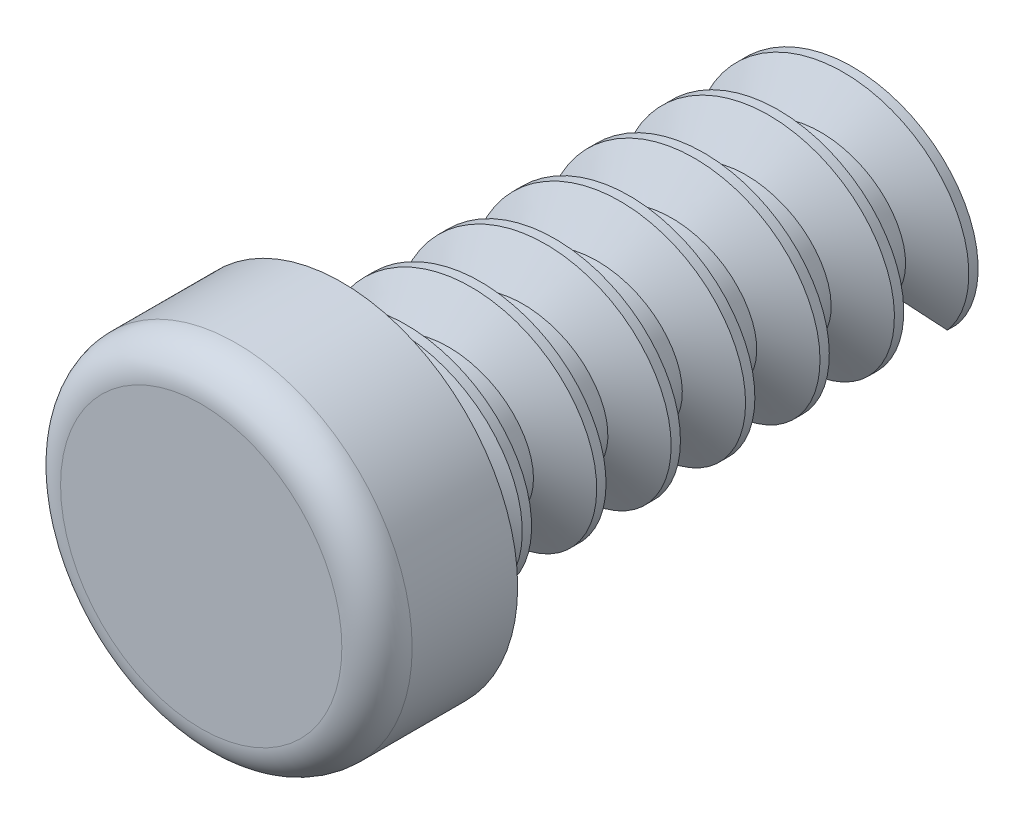
from build123d import *

# Parameters (mm, degrees)
SKETCH1_R           = 2.25
BOSS_EXTRUDE1_DEPTH = 15
THREAD1_PITCH       = 2.116666667
SKETCH4_R           = 5
BOSS_EXTRUDE2_DEPTH = 4
FILLET1_R           = 1


with BuildPart() as part:
    # Sketch1 → Boss-Extrude1 (new body)
    with BuildSketch(Plane.XY):
        Circle(SKETCH1_R)
    extrude(amount=BOSS_EXTRUDE1_DEPTH)

    # Thread1: the profile of Thread Profile1 profile screwed along a right-hand helix of 6.614173 turns, 10 arcs to a turn; built about Z, then put on its axis
    thread1_z = Axis((0, 0, 0), (0, 0, 1))
    thread1_corners = [(2.2497, 0, -0.000173205), (3.395679435, 0, 0.66145833), (3.395679435, 0, 0.926041664), (2.2497, 0, 1.587673199)]
    with BuildLine(mode=Mode.PRIVATE) as thread1_profile:
        Line(thread1_corners[0], thread1_corners[1])
        Line(thread1_corners[1], thread1_corners[2])
        Line(thread1_corners[2], thread1_corners[3])
        Line(thread1_corners[3], thread1_corners[0])
    thread1_cap = Face(thread1_profile.wire())
    thread1_turn_angles = [0, 18, 36, 54, 72, 90, 108, 126, 144, 162, 180, 198, 216, 234, 252, 270, 288, 306, 324, 342, 360]
    thread1_turn_weights = [1, 0.9510565162951535, 1, 0.9510565162951535, 1, 0.9510565162951535, 1, 0.9510565162951535, 1, 0.9510565162951535, 1, 0.9510565162951535, 1, 0.9510565162951535, 1, 0.9510565162951535, 1, 0.9510565162951535, 1, 0.9510565162951535, 1]
    thread1_turn_rails = [Edge.make_bspline([Vector(p[0], p[1], 0).rotate(thread1_z, thread1_turn_angles[k]) / thread1_turn_weights[k] + Vector(0, 0, p[2] + THREAD1_PITCH * thread1_turn_angles[k] / 360) for k in range(21)], [0, 0, 0, 1, 1, 2, 2, 3, 3, 4, 4, 5, 5, 6, 6, 7, 7, 8, 8, 9, 9, 10, 10, 10], 2, thread1_turn_weights) for p in thread1_corners]
    thread1_turn_sides = [Face.make_surface_from_curves(thread1_turn_rails[p[0]], thread1_turn_rails[p[1]]) for p in [(0, 1), (1, 2), (2, 3), (3, 0)]]
    thread1_last_angles = [2160, 2178, 2196, 2214, 2232, 2250, 2268, 2286, 2304, 2322, 2340, 2358, 2376, 2378.551181102, 2381.102362205]
    thread1_last_weights = [1, 0.9510565162951535, 1, 0.9510565162951535, 1, 0.9510565162951535, 1, 0.9510565162951535, 1, 0.9510565162951535, 1, 0.9510565162951535, 1, 0.9990088587214707, 1]
    thread1_last_rails = [Edge.make_bspline([Vector(p[0], p[1], 0).rotate(thread1_z, thread1_last_angles[k]) / thread1_last_weights[k] + Vector(0, 0, p[2] + THREAD1_PITCH * thread1_last_angles[k] / 360) for k in range(15)], [0, 0, 0, 1, 1, 2, 2, 3, 3, 4, 4, 5, 5, 6, 6, 7, 7, 7], 2, thread1_last_weights) for p in thread1_corners]
    thread1_last_sides = [Face.make_surface_from_curves(thread1_last_rails[p[0]], thread1_last_rails[p[1]]) for p in [(0, 1), (1, 2), (2, 3), (3, 0)]]
    thread1 = Plane(origin=(0, 0, 15), x_dir=(-1, 0, 0), z_dir=(0, 0, -1)) * Solid(Shell([*[p.moved(Location((0, 0, THREAD1_PITCH * i))) for i in range(6) for p in thread1_turn_sides], *thread1_last_sides, thread1_cap, thread1_cap.rotate(thread1_z, 2381.102362205).moved(Location((0, 0, THREAD1_PITCH * 2381.102362205 / 360)))]))
    add(thread1)

    # Sketch4 → Boss-Extrude2 (add)
    with BuildSketch(Plane.XY.offset(15)):
        Circle(SKETCH4_R)
    extrude(amount=BOSS_EXTRUDE2_DEPTH)

    # Fillet1
    fillet1_edges = [part.edges().sort_by_distance(p)[0] for p in [
        (-5, 0, 19),
    ]]
    fillet(fillet1_edges, radius=FILLET1_R)


solid = part.part
